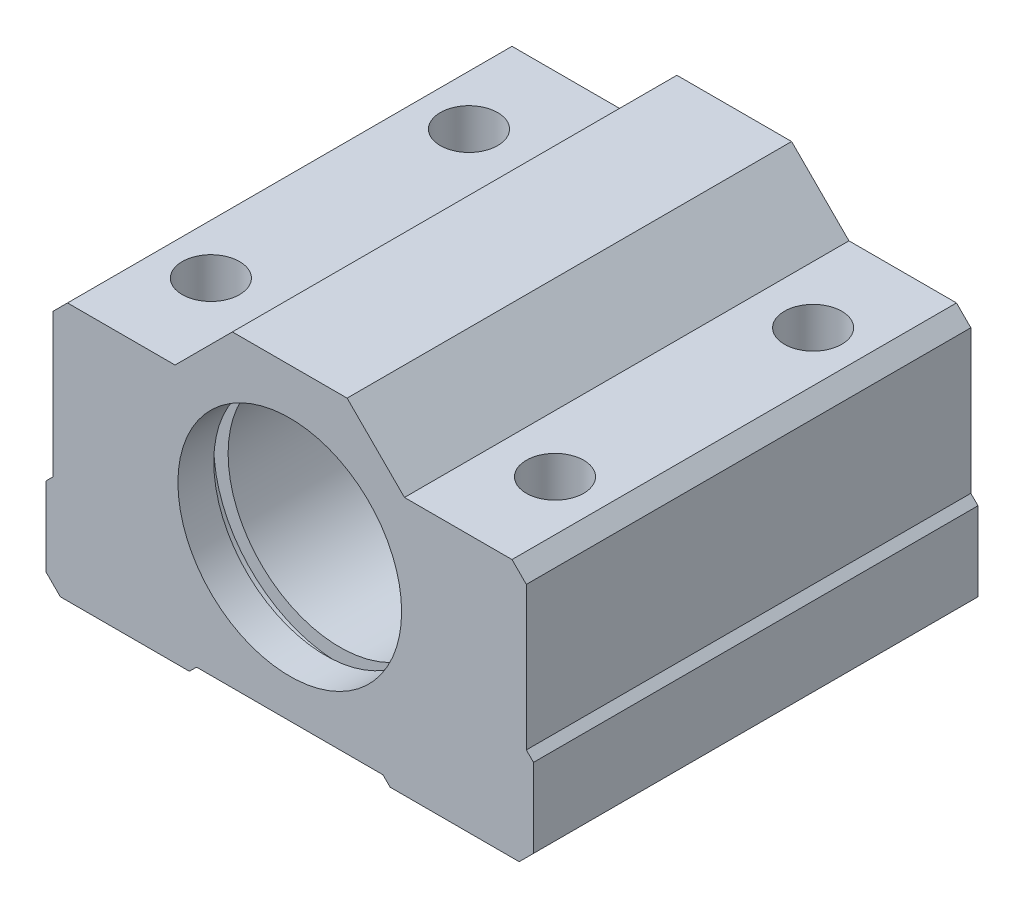
from build123d import *

# Parameters (mm, degrees)
SKETCH1_R           = 7.8
BOSS_EXTRUDE1_DEPTH = 31
CHAMFER1_SIZE       = 1
CHAMFER2_SIZE       = 1
CHAMFER3_SIZE       = 1
CHAMFER4_SIZE       = 1
SKETCH2_R           = 2
CUT_EXTRUDE1_DEPTH  = 18
SKETCH3_R           = 8.8
CUT_EXTRUDE2_DEPTH  = 3.5
CUT_EXTRUDE3_START  = -3.5
SKETCH4_R           = 8.8
CUT_EXTRUDE3_DEPTH  = 3.5
BOSS_EXTRUDE2_START = -2.5
SKETCH5_R           = 8.8
SKETCH5_R_2         = 7.8
BOSS_EXTRUDE2_DEPTH = 2.5
SKETCH6_R           = 8.8
SKETCH6_R_2         = 7.8
BOSS_EXTRUDE3_DEPTH = 2.5


with BuildPart() as part:
    # Sketch1 → Boss-Extrude1 (new body)
    with BuildSketch(Plane.XY):
        Polygon((-6, -7.931107296), (6, -7.931107296), (6, -8.431107296), (17, -8.431107296), (17, -0.931107296), (16.5, -0.931107296), (16.5, 9.568892704), (8, 9.568892704), (4, 13.568892704), (-4, 13.568892704), (-8, 9.568892704), (-16.5, 9.568892704), (-16.5, -0.931107296), (-17, -0.931107296), (-17, -8.431107296), (-6, -8.431107296), align=None)
        with Locations((0, 2.568892704)):
            Circle(SKETCH1_R, mode=Mode.SUBTRACT)
    extrude(amount=BOSS_EXTRUDE1_DEPTH)

    # Chamfer1
    chamfer1_edges = [part.edges().sort_by_distance(p)[0] for p in [
        (-16.5, 9.568892704, 15.5),
        (16.5, 9.568892704, 15.5),
    ]]
    chamfer(chamfer1_edges, length=CHAMFER1_SIZE)

    # Chamfer2
    # the kernel refuses this chamfer: 1 mm, written as the material it takes off along each edge
    with BuildSketch(Plane(origin=(-17, -0.931107296, -2.571682988), x_dir=(-0.02749587661058563, -0.9996219169112968, 0), z_dir=(0, 0, 1))) as chamfer2_piece_1_section:
        Polygon((CHAMFER2_SIZE * 0.999621916911, CHAMFER2_SIZE * 0.0274958766106), (-CHAMFER2_SIZE * 0.0274958766106, CHAMFER2_SIZE * 0.999621916911), (0, 0), align=None)
    chamfer2_piece_1 = extrude(amount=36.143365976, mode=Mode.PRIVATE)
    chamfer2_piece_1 = split(chamfer2_piece_1, bisect_by=Plane(origin=(-16.5, -1.32450838, 15.5), z_dir=(-1, 0, 0)), keep=Keep.TOP, mode=Mode.PRIVATE)
    add(chamfer2_piece_1, mode=Mode.SUBTRACT)
    with BuildSketch(Plane(origin=(17, -0.931107296, -2.571682988), x_dir=(-0.9996219169112968, 0.027495876610586403, 0), z_dir=(0, 0, 1))) as chamfer2_piece_2_section:
        Polygon((CHAMFER2_SIZE * 0.999621916911, CHAMFER2_SIZE * 0.0274958766106), (-CHAMFER2_SIZE * 0.0274958766106, CHAMFER2_SIZE * 0.999621916911), (0, 0), align=None)
    chamfer2_piece_2 = extrude(amount=36.143365976, mode=Mode.PRIVATE)
    chamfer2_piece_2 = split(chamfer2_piece_2, bisect_by=Plane(origin=(16.5, -1.32450838, 15.5), z_dir=(1, 0, 0)), keep=Keep.TOP, mode=Mode.PRIVATE)
    add(chamfer2_piece_2, mode=Mode.SUBTRACT)

    # Chamfer3
    chamfer3_edges = [part.edges().sort_by_distance(p)[0] for p in [
        (-17, -8.431107296, 15.5),
        (17, -8.431107296, 15.5),
    ]]
    chamfer(chamfer3_edges, length=CHAMFER3_SIZE)

    # Chamfer4
    # the kernel refuses this chamfer: 1 mm, written as the material it takes off along each edge
    with BuildSketch(Plane(origin=(-6, -8.431107296, -2.571682988), x_dir=(-0.9996219169112968, -0.027495876610585623, 0), z_dir=(0, 0, 1))) as chamfer4_piece_1_section:
        Polygon((CHAMFER4_SIZE * 0.999621916911, -CHAMFER4_SIZE * 0.0274958766106), (-CHAMFER4_SIZE * 0.0274958766106, -CHAMFER4_SIZE * 0.999621916911), (0, 0), align=None)
    chamfer4_piece_1 = extrude(amount=36.143365976, mode=Mode.PRIVATE)
    chamfer4_piece_1 = split(chamfer4_piece_1, bisect_by=Plane(origin=(-6.393401084, -7.931107296, 15.5), z_dir=(0, -1, 0)), keep=Keep.TOP, mode=Mode.PRIVATE)
    add(chamfer4_piece_1, mode=Mode.SUBTRACT)
    with BuildSketch(Plane(origin=(6, -8.431107296, -2.571682988), x_dir=(-0.027495876610586487, 0.9996219169112968, 0), z_dir=(0, 0, 1))) as chamfer4_piece_2_section:
        Polygon((CHAMFER4_SIZE * 0.999621916911, -CHAMFER4_SIZE * 0.0274958766106), (-CHAMFER4_SIZE * 0.0274958766106, -CHAMFER4_SIZE * 0.999621916911), (0, 0), align=None)
    chamfer4_piece_2 = extrude(amount=36.143365976, mode=Mode.PRIVATE)
    chamfer4_piece_2 = split(chamfer4_piece_2, bisect_by=Plane(origin=(6.393401084, -7.931107296, 15.5), z_dir=(0, -1, 0)), keep=Keep.TOP, mode=Mode.PRIVATE)
    add(chamfer4_piece_2, mode=Mode.SUBTRACT)

    # Sketch2 → Cut-Extrude1 (cut)
    with BuildSketch(Plane.XZ.offset(8.431107296)):
        with Locations(Location((-12, 6.5, 0), (0, 0, 270))):
            Circle(SKETCH2_R)
        with Locations(Location((-12, 24.5, 0), (0, 0, 270))):
            Circle(SKETCH2_R)
        with Locations(Location((12, 6.5, 0), (0, 0, 270))):
            Circle(SKETCH2_R)
        with Locations(Location((12, 24.5, 0), (0, 0, 270))):
            Circle(SKETCH2_R)
    extrude(amount=-CUT_EXTRUDE1_DEPTH, mode=Mode.SUBTRACT)

    # Sketch3 → Cut-Extrude2 (cut)
    with BuildSketch(Plane.XY.offset(31)):
        with Locations((0, 2.568892704)):
            Circle(SKETCH3_R)
    extrude(amount=-CUT_EXTRUDE2_DEPTH, mode=Mode.SUBTRACT)

    # Sketch4 → Cut-Extrude3 (cut)
    with BuildSketch(Plane(origin=(0, 0, 0), x_dir=(-1, 0, 0), z_dir=(0, 0, -1)).offset(CUT_EXTRUDE3_START)):
        with Locations(Location((0, 2.568892704, 0), (0, 0, 180))):
            Circle(SKETCH4_R)
    extrude(amount=CUT_EXTRUDE3_DEPTH, mode=Mode.SUBTRACT)

    # Sketch5 → Boss-Extrude2 (add)
    with BuildSketch(Plane(origin=(0, 0, 0), x_dir=(-1, 0, 0), z_dir=(0, 0, -1)).offset(BOSS_EXTRUDE2_START)):
        with Locations((0, 2.568892704)):
            Circle(SKETCH5_R)
        with Locations((0, 2.568892704)):
            Circle(SKETCH5_R_2, mode=Mode.SUBTRACT)
    extrude(amount=BOSS_EXTRUDE2_DEPTH)

    # Sketch6 → Boss-Extrude3 (add)
    with BuildSketch(Plane.XY.offset(31)):
        with Locations((0, 2.568892704)):
            Circle(SKETCH6_R)
        with Locations(Location((0, 2.568892704, 0), (0, 0, 180))):
            Circle(SKETCH6_R_2, mode=Mode.SUBTRACT)
    extrude(amount=-BOSS_EXTRUDE3_DEPTH)


solid = part.part
